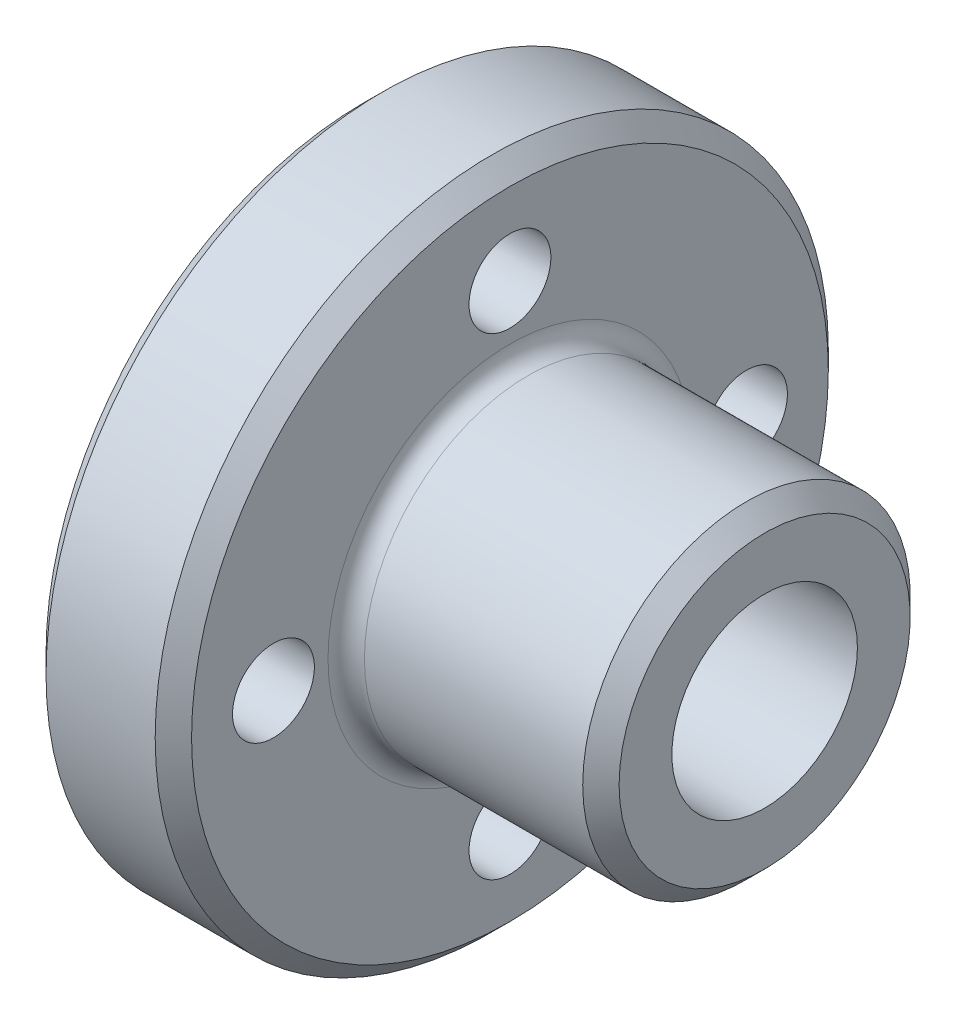
from build123d import *

# Parameters (mm, degrees)
FORO_LAMATO_PER_VITE_M4_A_TESTA_CILINDRI_D           = 4.5
FORO_LAMATO_PER_VITE_M4_A_TESTA_CILINDRI_CBORE_D     = 8
FORO_LAMATO_PER_VITE_M4_A_TESTA_CILINDRI_CBORE_DEPTH = 2.6
RIPETIZIONECIRCOLARE1_COUNT                          = 4
RACCORDO1_R                                          = 1
SMUSSO1_SIZE                                         = 1
FORO_FILETTATO_M12_1_D                               = 10.2
FORO_FILETTATO_M12_1_DEPTH                           = 32.75
FORO_FILETTATO_M12_1_TIP                             = 3.064389157
SMUSSO2_SIZE                                         = 1


with BuildPart() as part:
    # Schizzo1 → Rivoluzione1 (revolve)
    with BuildSketch(Plane.XY):
        Polygon((0, 0), (0, 18.5), (8, 18.5), (8, 9), (22, 9), (22, 0), align=None)
    revolve(axis=Axis((22, 0, 0), (-1, 0, 0)))

    # Foro lamato per Vite M4 a testa cilindrica piana-1 (through all)
    with Locations(Plane.ZY):
        with Locations((0, 13)):
            foro_lamato_per_vite_m4_a_testa_cilindri = CounterBoreHole(FORO_LAMATO_PER_VITE_M4_A_TESTA_CILINDRI_D / 2, FORO_LAMATO_PER_VITE_M4_A_TESTA_CILINDRI_CBORE_D / 2, FORO_LAMATO_PER_VITE_M4_A_TESTA_CILINDRI_CBORE_DEPTH)

    # RipetizioneCircolare1: Foro lamato per Vite M4 a testa cilindrica piana-1 ×4 about axis
    ripetizionecircolare1_axis = Axis((0, 0, 0), (-1, 0, 0))
    for i in range(1, RIPETIZIONECIRCOLARE1_COUNT):
        add(foro_lamato_per_vite_m4_a_testa_cilindri.rotate(ripetizionecircolare1_axis, i * 360 / RIPETIZIONECIRCOLARE1_COUNT), mode=Mode.SUBTRACT)

    # Raccordo1
    raccordo1_edges = [part.edges().sort_by_distance(p)[0] for p in [
        (8, -9, 0),
    ]]
    fillet(raccordo1_edges, radius=RACCORDO1_R)

    # Smusso1
    smusso1_edges = [part.edges().sort_by_distance(p)[0] for p in [
        (0, -18.5, 0),
        (8, -18.5, 0),
        (22, -9, 0),
    ]]
    chamfer(smusso1_edges, length=SMUSSO1_SIZE)

    # Foro filettato M12-1
    with Locations(Plane(origin=(22, 0, 0), x_dir=(0, 0, -1), z_dir=(1, 0, 0))):
        with Locations((0, 0)):
            Hole(FORO_FILETTATO_M12_1_D / 2, depth=FORO_FILETTATO_M12_1_DEPTH)
            with Locations((0, 0, -(FORO_FILETTATO_M12_1_DEPTH + FORO_FILETTATO_M12_1_TIP / 2))):  # 118° drill point
                Cone(0, FORO_FILETTATO_M12_1_D / 2, FORO_FILETTATO_M12_1_TIP, mode=Mode.SUBTRACT)

    # Smusso2
    smusso2_edges = [part.edges().sort_by_distance(p)[0] for p in [
        (0, 0, -5.1),
    ]]
    chamfer(smusso2_edges, length=SMUSSO2_SIZE)


solid = part.part
